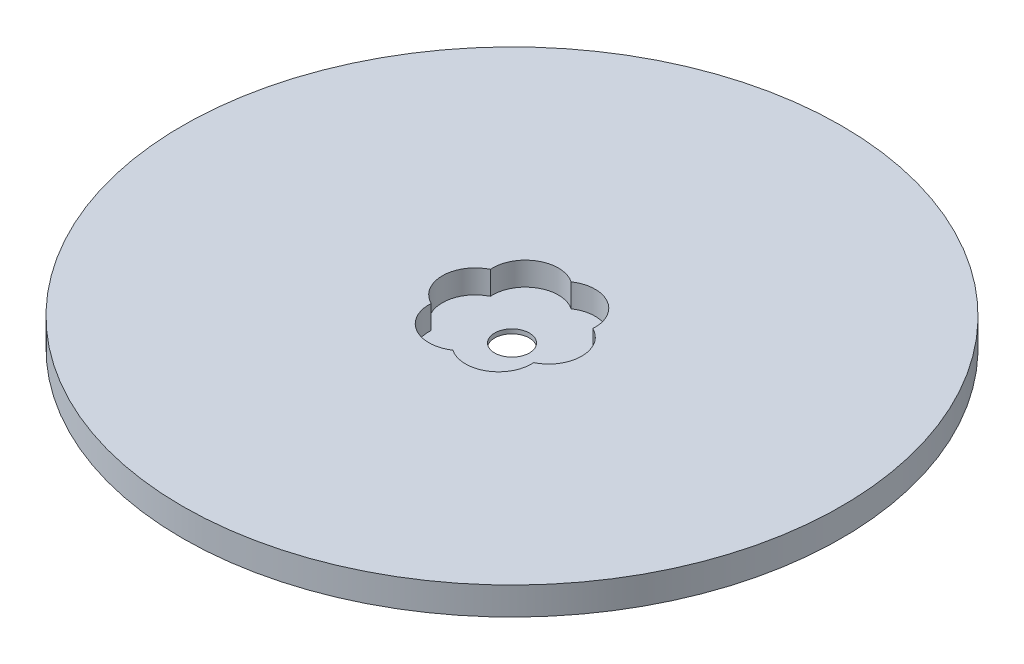
from build123d import *

# Parameters (mm, degrees)
SKETCH1_R           = 95
BOSS_EXTRUDE1_DEPTH = 8
SKETCH2_R           = 5
CUT_EXTRUDE1_DEPTH  = 135.588261004
SKETCH3_R           = 9.498426828
CUT_EXTRUDE2_DEPTH  = 6.74398575
CIRPATTERN1_COUNT   = 6


with BuildPart() as part:
    # Sketch1 → Boss-Extrude1 (new body)
    with BuildSketch(Plane(origin=(0, 0, 0), x_dir=(1, 0, 0), z_dir=(0, 1, 0))):
        Circle(SKETCH1_R)
    extrude(amount=BOSS_EXTRUDE1_DEPTH)

    # Sketch2 → Cut-Extrude1 (cut, through all)
    with BuildSketch(Plane(origin=(0, 0, 0), x_dir=(1, 0, 0), z_dir=(0, 1, 0))):
        Circle(SKETCH2_R)
    extrude(amount=CUT_EXTRUDE1_DEPTH, mode=Mode.SUBTRACT)

    # Sketch3 → Cut-Extrude2 (cut)
    with BuildSketch(Plane(origin=(0, 8, 0), x_dir=(1, 0, 0), z_dir=(0, 1, 0))):
        with Locations((-10.59166458, 0)):
            Circle(SKETCH3_R)
    cut_extrude2 = extrude(amount=-CUT_EXTRUDE2_DEPTH, mode=Mode.SUBTRACT)

    # CirPattern1: Cut-Extrude2 ×6 about axis
    cirpattern1_axis = Axis((0, 0, 0), (0, 1, 0))
    for i in range(1, CIRPATTERN1_COUNT):
        add(cut_extrude2.rotate(cirpattern1_axis, i * 360 / CIRPATTERN1_COUNT), mode=Mode.SUBTRACT)


solid = part.part
